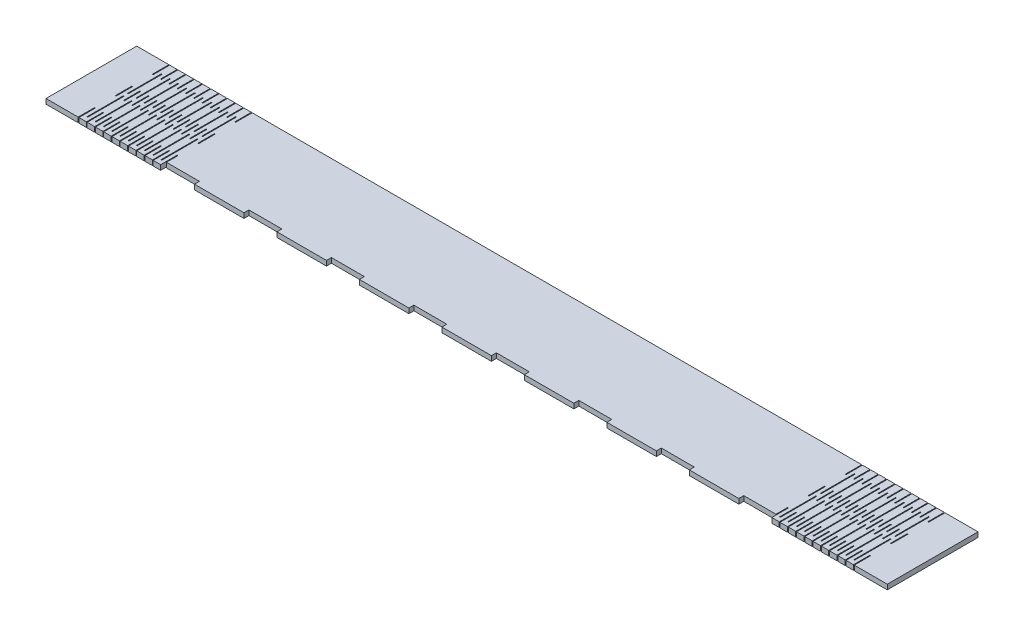
from build123d import *

# Parameters (mm, degrees)
SKETCH1_W               = 510
SKETCH1_H               = 55
BOSS_EXTRUDE1_DEPTH     = 3
SKETCH2_W               = 20
SKETCH2_H               = 3
CUT_EXTRUDE1_DEPTH      = 257.496101335
SKETCH3_W               = 0.5
SKETCH3_H               = 10
SKETCH3_H_2             = 20.5
SKETCH3_H_3             = 22
CUT_EXTRUDE_THIN2_DEPTH = 10


with BuildPart() as part:
    # Sketch1 → Boss-Extrude1 (new body)
    with BuildSketch(Plane(origin=(0, 0, 0), x_dir=(1, 0, 0), z_dir=(0, 1, 0))):
        Rectangle(SKETCH1_W, SKETCH1_H)
    extrude(amount=BOSS_EXTRUDE1_DEPTH)

    # Sketch2 → Cut-Extrude1 (cut, through all)
    with BuildSketch(Plane(origin=(0, 3, 0), x_dir=(1, 0, 0), z_dir=(0, 1, 0))):
        with Locations((-175, -26)):
            Rectangle(SKETCH2_W, SKETCH2_H)
        with Locations((175, -26)):
            Rectangle(SKETCH2_W, SKETCH2_H)
        with Locations((125, -26)):
            Rectangle(SKETCH2_W, SKETCH2_H)
        with Locations((75, -26)):
            Rectangle(SKETCH2_W, SKETCH2_H)
        with Locations((25, -26)):
            Rectangle(SKETCH2_W, SKETCH2_H)
        with Locations((-25, -26)):
            Rectangle(SKETCH2_W, SKETCH2_H)
        with Locations((-75, -26)):
            Rectangle(SKETCH2_W, SKETCH2_H)
        with Locations((-125, -26)):
            Rectangle(SKETCH2_W, SKETCH2_H)
    extrude(amount=-CUT_EXTRUDE1_DEPTH, mode=Mode.SUBTRACT)

    # Sketch3 → Cut-Extrude-Thin2 (cut)
    with BuildSketch(Plane(origin=(0, 3, 0), x_dir=(1, 0, 0), z_dir=(0, 1, 0))):
        with Locations((184.75, 22.5)):
            Rectangle(SKETCH3_W, SKETCH3_H)
        with Locations((189.75, 22.5)):
            Rectangle(SKETCH3_W, SKETCH3_H)
        with Locations((194.75, 22.5)):
            Rectangle(SKETCH3_W, SKETCH3_H)
        with Locations((199.75, 22.5)):
            Rectangle(SKETCH3_W, SKETCH3_H)
        with Locations((204.75, 22.5)):
            Rectangle(SKETCH3_W, SKETCH3_H)
        with Locations((209.75, 22.5)):
            Rectangle(SKETCH3_W, SKETCH3_H)
        with Locations((214.75, 22.5)):
            Rectangle(SKETCH3_W, SKETCH3_H)
        with Locations((219.75, 22.5)):
            Rectangle(SKETCH3_W, SKETCH3_H)
        with Locations((224.75, 22.5)):
            Rectangle(SKETCH3_W, SKETCH3_H)
        with Locations((229.75, 22.5)):
            Rectangle(SKETCH3_W, SKETCH3_H)
        with Locations((234.75, 22.5)):
            Rectangle(SKETCH3_W, SKETCH3_H)
        with Locations((184.75, 0)):
            Rectangle(SKETCH3_W, SKETCH3_H)
        with Locations((184.75, -22.5)):
            Rectangle(SKETCH3_W, SKETCH3_H)
        with Locations((189.75, 0)):
            Rectangle(SKETCH3_W, SKETCH3_H)
        with Locations((189.75, -22.5)):
            Rectangle(SKETCH3_W, SKETCH3_H)
        with Locations((194.75, 0)):
            Rectangle(SKETCH3_W, SKETCH3_H)
        with Locations((194.75, -22.5)):
            Rectangle(SKETCH3_W, SKETCH3_H)
        with Locations((199.75, 0)):
            Rectangle(SKETCH3_W, SKETCH3_H)
        with Locations((199.75, -22.5)):
            Rectangle(SKETCH3_W, SKETCH3_H)
        with Locations((204.75, 0)):
            Rectangle(SKETCH3_W, SKETCH3_H)
        with Locations((204.75, -22.5)):
            Rectangle(SKETCH3_W, SKETCH3_H)
        with Locations((209.75, 0)):
            Rectangle(SKETCH3_W, SKETCH3_H)
        with Locations((209.75, -22.5)):
            Rectangle(SKETCH3_W, SKETCH3_H)
        with Locations((214.75, 0)):
            Rectangle(SKETCH3_W, SKETCH3_H)
        with Locations((214.75, -22.5)):
            Rectangle(SKETCH3_W, SKETCH3_H)
        with Locations((219.75, 0)):
            Rectangle(SKETCH3_W, SKETCH3_H)
        with Locations((219.75, -22.5)):
            Rectangle(SKETCH3_W, SKETCH3_H)
        with Locations((224.75, 0)):
            Rectangle(SKETCH3_W, SKETCH3_H)
        with Locations((224.75, -22.5)):
            Rectangle(SKETCH3_W, SKETCH3_H)
        with Locations((229.75, 0)):
            Rectangle(SKETCH3_W, SKETCH3_H)
        with Locations((229.75, -22.5)):
            Rectangle(SKETCH3_W, SKETCH3_H)
        with Locations((234.75, 0)):
            Rectangle(SKETCH3_W, SKETCH3_H)
        with Locations((234.75, -22.5)):
            Rectangle(SKETCH3_W, SKETCH3_H)
        with Locations((187.25, 10.25)):
            Rectangle(SKETCH3_W, SKETCH3_H_2)
        with Locations((187.25, -13.75)):
            Rectangle(SKETCH3_W, SKETCH3_H_3)
        with Locations((192.25, 10.25)):
            Rectangle(SKETCH3_W, SKETCH3_H_2)
        with Locations((192.25, -13.75)):
            Rectangle(SKETCH3_W, SKETCH3_H_3)
        with Locations((197.25, 10.25)):
            Rectangle(SKETCH3_W, SKETCH3_H_2)
        with Locations((197.25, -13.75)):
            Rectangle(SKETCH3_W, SKETCH3_H_3)
        with Locations((202.25, 10.25)):
            Rectangle(SKETCH3_W, SKETCH3_H_2)
        with Locations((202.25, -13.75)):
            Rectangle(SKETCH3_W, SKETCH3_H_3)
        with Locations((207.25, 10.25)):
            Rectangle(SKETCH3_W, SKETCH3_H_2)
        with Locations((207.25, -13.75)):
            Rectangle(SKETCH3_W, SKETCH3_H_3)
        with Locations((212.25, 10.25)):
            Rectangle(SKETCH3_W, SKETCH3_H_2)
        with Locations((212.25, -13.75)):
            Rectangle(SKETCH3_W, SKETCH3_H_3)
        with Locations((217.25, 10.25)):
            Rectangle(SKETCH3_W, SKETCH3_H_2)
        with Locations((217.25, -13.75)):
            Rectangle(SKETCH3_W, SKETCH3_H_3)
        with Locations((222.25, 10.25)):
            Rectangle(SKETCH3_W, SKETCH3_H_2)
        with Locations((222.25, -13.75)):
            Rectangle(SKETCH3_W, SKETCH3_H_3)
        with Locations((227.25, 10.25)):
            Rectangle(SKETCH3_W, SKETCH3_H_2)
        with Locations((227.25, -13.75)):
            Rectangle(SKETCH3_W, SKETCH3_H_3)
        with Locations((232.25, 10.25)):
            Rectangle(SKETCH3_W, SKETCH3_H_2)
        with Locations((232.25, -13.75)):
            Rectangle(SKETCH3_W, SKETCH3_H_3)
        with Locations((-232.75, -13.75)):
            Rectangle(SKETCH3_W, SKETCH3_H_3)
        with Locations((-232.75, 10.25)):
            Rectangle(SKETCH3_W, SKETCH3_H_2)
        with Locations((-227.75, -13.75)):
            Rectangle(SKETCH3_W, SKETCH3_H_3)
        with Locations((-227.75, 10.25)):
            Rectangle(SKETCH3_W, SKETCH3_H_2)
        with Locations((-222.75, -13.75)):
            Rectangle(SKETCH3_W, SKETCH3_H_3)
        with Locations((-222.75, 10.25)):
            Rectangle(SKETCH3_W, SKETCH3_H_2)
        with Locations((-217.75, -13.75)):
            Rectangle(SKETCH3_W, SKETCH3_H_3)
        with Locations((-217.75, 10.25)):
            Rectangle(SKETCH3_W, SKETCH3_H_2)
        with Locations((-212.75, -13.75)):
            Rectangle(SKETCH3_W, SKETCH3_H_3)
        with Locations((-212.75, 10.25)):
            Rectangle(SKETCH3_W, SKETCH3_H_2)
        with Locations((-207.75, -13.75)):
            Rectangle(SKETCH3_W, SKETCH3_H_3)
        with Locations((-207.75, 10.25)):
            Rectangle(SKETCH3_W, SKETCH3_H_2)
        with Locations((-202.75, -13.75)):
            Rectangle(SKETCH3_W, SKETCH3_H_3)
        with Locations((-202.75, 10.25)):
            Rectangle(SKETCH3_W, SKETCH3_H_2)
        with Locations((-197.75, -13.75)):
            Rectangle(SKETCH3_W, SKETCH3_H_3)
        with Locations((-197.75, 10.25)):
            Rectangle(SKETCH3_W, SKETCH3_H_2)
        with Locations((-192.75, -13.75)):
            Rectangle(SKETCH3_W, SKETCH3_H_3)
        with Locations((-192.75, 10.25)):
            Rectangle(SKETCH3_W, SKETCH3_H_2)
        with Locations((-187.75, -13.75)):
            Rectangle(SKETCH3_W, SKETCH3_H_3)
        with Locations((-187.75, 10.25)):
            Rectangle(SKETCH3_W, SKETCH3_H_2)
        with Locations((-235.25, -22.5)):
            Rectangle(SKETCH3_W, SKETCH3_H)
        with Locations((-235.25, 0)):
            Rectangle(SKETCH3_W, SKETCH3_H)
        with Locations((-230.25, -22.5)):
            Rectangle(SKETCH3_W, SKETCH3_H)
        with Locations((-230.25, 0)):
            Rectangle(SKETCH3_W, SKETCH3_H)
        with Locations((-225.25, -22.5)):
            Rectangle(SKETCH3_W, SKETCH3_H)
        with Locations((-225.25, 0)):
            Rectangle(SKETCH3_W, SKETCH3_H)
        with Locations((-220.25, -22.5)):
            Rectangle(SKETCH3_W, SKETCH3_H)
        with Locations((-220.25, 0)):
            Rectangle(SKETCH3_W, SKETCH3_H)
        with Locations((-215.25, -22.5)):
            Rectangle(SKETCH3_W, SKETCH3_H)
        with Locations((-215.25, 0)):
            Rectangle(SKETCH3_W, SKETCH3_H)
        with Locations((-210.25, -22.5)):
            Rectangle(SKETCH3_W, SKETCH3_H)
        with Locations((-210.25, 0)):
            Rectangle(SKETCH3_W, SKETCH3_H)
        with Locations((-205.25, -22.5)):
            Rectangle(SKETCH3_W, SKETCH3_H)
        with Locations((-205.25, 0)):
            Rectangle(SKETCH3_W, SKETCH3_H)
        with Locations((-200.25, -22.5)):
            Rectangle(SKETCH3_W, SKETCH3_H)
        with Locations((-200.25, 0)):
            Rectangle(SKETCH3_W, SKETCH3_H)
        with Locations((-195.25, -22.5)):
            Rectangle(SKETCH3_W, SKETCH3_H)
        with Locations((-195.25, 0)):
            Rectangle(SKETCH3_W, SKETCH3_H)
        with Locations((-190.25, -22.5)):
            Rectangle(SKETCH3_W, SKETCH3_H)
        with Locations((-190.25, 0)):
            Rectangle(SKETCH3_W, SKETCH3_H)
        with Locations((-185.25, -22.5)):
            Rectangle(SKETCH3_W, SKETCH3_H)
        with Locations((-185.25, 0)):
            Rectangle(SKETCH3_W, SKETCH3_H)
        with Locations((-235.25, 22.5)):
            Rectangle(SKETCH3_W, SKETCH3_H)
        with Locations((-230.25, 22.5)):
            Rectangle(SKETCH3_W, SKETCH3_H)
        with Locations((-225.25, 22.5)):
            Rectangle(SKETCH3_W, SKETCH3_H)
        with Locations((-220.25, 22.5)):
            Rectangle(SKETCH3_W, SKETCH3_H)
        with Locations((-215.25, 22.5)):
            Rectangle(SKETCH3_W, SKETCH3_H)
        with Locations((-210.25, 22.5)):
            Rectangle(SKETCH3_W, SKETCH3_H)
        with Locations((-205.25, 22.5)):
            Rectangle(SKETCH3_W, SKETCH3_H)
        with Locations((-200.25, 22.5)):
            Rectangle(SKETCH3_W, SKETCH3_H)
        with Locations((-195.25, 22.5)):
            Rectangle(SKETCH3_W, SKETCH3_H)
        with Locations((-190.25, 22.5)):
            Rectangle(SKETCH3_W, SKETCH3_H)
        with Locations((-185.25, 22.5)):
            Rectangle(SKETCH3_W, SKETCH3_H)
    extrude(amount=-CUT_EXTRUDE_THIN2_DEPTH, mode=Mode.SUBTRACT)


solid = part.part
